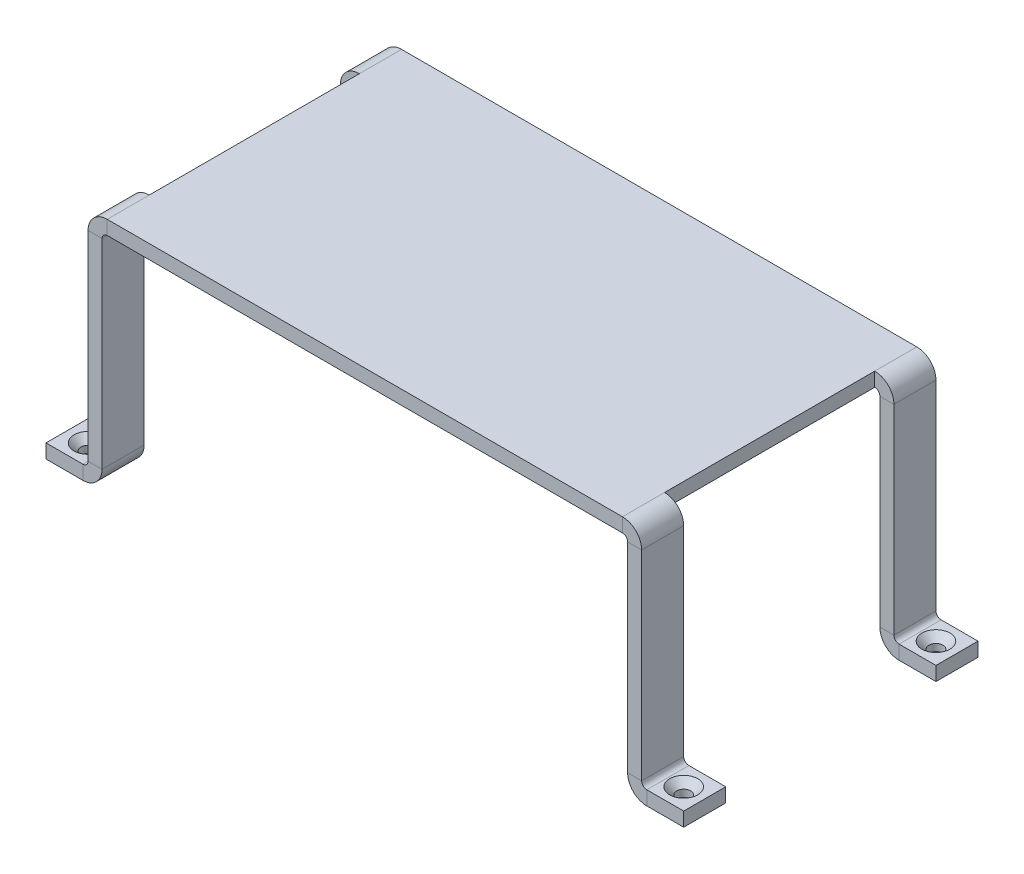
from build123d import *

# Parameters (mm, degrees)
SKETCH_2_W                       = 75
SKETCH_2_H                       = 42
SM_BASE_FLANGE_1_DEPTH           = 2
SM_EDGE_FLANGE_1_STRIP_W         = 9.4732
SM_EDGE_FLANGE_1_STRIP_H         = 2
SM_EDGE_FLANGE_1_STRIP_CUT_DEPTH = 42
SM_EDGE_FLANGE_1_DEPTH           = 42
SM_EDGE_FLANGE_2_STRIP_W         = 9.4732
SM_EDGE_FLANGE_2_STRIP_H         = 2
SM_EDGE_FLANGE_2_STRIP_CUT_DEPTH = 42
SM_EDGE_FLANGE_2_DEPTH           = 42
SM_EDGE_FLANGE_3_STRIP_W         = 9.4732
SM_EDGE_FLANGE_3_STRIP_H         = 2
SM_EDGE_FLANGE_3_STRIP_CUT_DEPTH = 42
SM_EDGE_FLANGE_3_DEPTH           = 42
SM_EDGE_FLANGE_4_STRIP_W         = 9.4732
SM_EDGE_FLANGE_4_STRIP_H         = 2
SM_EDGE_FLANGE_4_STRIP_CUT_DEPTH = 42
SM_EDGE_FLANGE_4_DEPTH           = 42
HOLE_WIZARD_M2_4_AT_2_COUNT      = 2
HOLE_WIZARD_M2_4_AT_2_PITCH      = 36
HOLE_WIZARD_M2_4_AT_3_COUNT      = 2
HOLE_WIZARD_M2_4_AT_3_PITCH      = 85
HOLE_WIZARD_M2_4_AT_4_COUNT      = 2
HOLE_WIZARD_M2_4_AT_4_PITCH      = 92.309262807
SKETCH_27_W                      = 8.7366
SKETCH_27_H                      = 30
CUT_EXTRUDE_2319_DEPTH           = 38


# Sheet-metal steps are written as plain solids
with BuildPart() as part:
    # Sketch 2 → 基体-法兰1 (new body)
    with BuildSketch(Plane(origin=(0, 0, 0), x_dir=(1, 0, 0), z_dir=(0, 1, 0))):
        with Locations((21.966960091, -5.622610863)):
            Rectangle(SKETCH_2_W, SKETCH_2_H)
    extrude(amount=-SM_BASE_FLANGE_1_DEPTH)

    # 边线-法兰1 strip (across the edge) → 边线-法兰1 strip cut (cut)
    with BuildSketch(Plane(origin=(-15.533039909, -2, 26.622610863), x_dir=(1, 0, 0), z_dir=(0, 0, -1))):
        with Locations((-4, -1)):
            Rectangle(SM_EDGE_FLANGE_1_STRIP_W, SM_EDGE_FLANGE_1_STRIP_H)
    extrude(amount=SM_EDGE_FLANGE_1_STRIP_CUT_DEPTH, mode=Mode.SUBTRACT)

    # 边线-法兰1 section (across the edge) → 边线-法兰1 (add)
    with BuildSketch(Plane(origin=(-15.533039909, -2, 26.622610863), x_dir=(1, 0, 0), z_dir=(0, 0, -1))):
        with BuildLine():
            Line((-2, 0.7366), (-2, 30))
            Line((-2, 30), (0, 30))
            Line((0, 30), (0, 0.7366))
            ThreePointArc((0, 0.7366), (0.215745145, 0.215745145), (0.7366, 0))
            Line((0.7366, 0), (0.7366, -2))
            ThreePointArc((0.7366, -2), (-1.198468417, -1.198468417), (-2, 0.7366))
        make_face()
    extrude(amount=SM_EDGE_FLANGE_1_DEPTH)

    # 边线-法兰2 strip (across the edge) → 边线-法兰2 strip cut (cut)
    with BuildSketch(Plane(origin=(59.466960091, -2, -15.377389137), x_dir=(-1, 0, 0), z_dir=(0, 0, 1))):
        with Locations((-4, -1)):
            Rectangle(SM_EDGE_FLANGE_2_STRIP_W, SM_EDGE_FLANGE_2_STRIP_H)
    extrude(amount=SM_EDGE_FLANGE_2_STRIP_CUT_DEPTH, mode=Mode.SUBTRACT)

    # 边线-法兰2 section (across the edge) → 边线-法兰2 (add)
    with BuildSketch(Plane(origin=(59.466960091, -2, -15.377389137), x_dir=(-1, 0, 0), z_dir=(0, 0, 1))):
        with BuildLine():
            Line((-2, 0.7366), (-2, 30))
            Line((-2, 30), (0, 30))
            Line((0, 30), (0, 0.7366))
            ThreePointArc((0, 0.7366), (0.215745145, 0.215745145), (0.7366, 0))
            Line((0.7366, 0), (0.7366, -2))
            ThreePointArc((0.7366, -2), (-1.198468417, -1.198468417), (-2, 0.7366))
        make_face()
    extrude(amount=SM_EDGE_FLANGE_2_DEPTH)

    # 边线-法兰3 strip (across the edge) → 边线-法兰3 strip cut (cut)
    with BuildSketch(Plane(origin=(-17.533039909, -32, -15.377389137), x_dir=(0, 1, 0), z_dir=(0, 0, 1))):
        with Locations((-4, -1)):
            Rectangle(SM_EDGE_FLANGE_3_STRIP_W, SM_EDGE_FLANGE_3_STRIP_H)
    extrude(amount=SM_EDGE_FLANGE_3_STRIP_CUT_DEPTH, mode=Mode.SUBTRACT)

    # 边线-法兰3 section (across the edge) → 边线-法兰3 (add)
    with BuildSketch(Plane(origin=(-17.533039909, -32, -15.377389137), x_dir=(0, 1, 0), z_dir=(0, 0, 1))):
        with BuildLine():
            Line((-2, 0.7366), (-2, 6))
            Line((-2, 6), (0, 6))
            Line((0, 6), (0, 0.7366))
            ThreePointArc((0, 0.7366), (0.215745145, 0.215745145), (0.7366, 0))
            Line((0.7366, 0), (0.7366, -2))
            ThreePointArc((0.7366, -2), (-1.198468417, -1.198468417), (-2, 0.7366))
        make_face()
    extrude(amount=SM_EDGE_FLANGE_3_DEPTH)

    # 边线-法兰4 strip (across the edge) → 边线-法兰4 strip cut (cut)
    with BuildSketch(Plane(origin=(61.466960091, -32, 26.622610863), x_dir=(0, 1, 0), z_dir=(0, 0, -1))):
        with Locations((-4, -1)):
            Rectangle(SM_EDGE_FLANGE_4_STRIP_W, SM_EDGE_FLANGE_4_STRIP_H)
    extrude(amount=SM_EDGE_FLANGE_4_STRIP_CUT_DEPTH, mode=Mode.SUBTRACT)

    # 边线-法兰4 section (across the edge) → 边线-法兰4 (add)
    with BuildSketch(Plane(origin=(61.466960091, -32, 26.622610863), x_dir=(0, 1, 0), z_dir=(0, 0, -1))):
        with BuildLine():
            Line((-2, 0.7366), (-2, 6))
            Line((-2, 6), (0, 6))
            Line((0, 6), (0, 0.7366))
            ThreePointArc((0, 0.7366), (0.215745145, 0.215745145), (0.7366, 0))
            Line((0.7366, 0), (0.7366, -2))
            ThreePointArc((0.7366, -2), (-1.198468417, -1.198468417), (-2, 0.7366))
        make_face()
    extrude(amount=SM_EDGE_FLANGE_4_DEPTH)

    # 草图26 → M2*4 (revolve, cut)
    with BuildSketch(Plane(origin=(-20.533039909, -32, -12.377389137), x_dir=(0, 0, 1), z_dir=(1, 0, 0))):
        Polygon((0, 0), (0, 2), (1, 2), (1, 1), (2, 0), align=None)
    hole_wizard_m2_4 = revolve(axis=Axis((-20.533039909, -25.65, -12.377389137), (0, -1, 0)), mode=Mode.SUBTRACT)

    # M2*4 at 2: M2*4 ×2
    with Locations(*[(0, 0, i * HOLE_WIZARD_M2_4_AT_2_PITCH) for i in range(1, HOLE_WIZARD_M2_4_AT_2_COUNT)]):
        add(hole_wizard_m2_4, mode=Mode.SUBTRACT)

    # M2*4 at 3: M2*4 ×2
    with Locations(*[(i * HOLE_WIZARD_M2_4_AT_3_PITCH, 0, 0) for i in range(1, HOLE_WIZARD_M2_4_AT_3_COUNT)]):
        add(hole_wizard_m2_4, mode=Mode.SUBTRACT)

    # M2*4 at 4: M2*4 ×2
    with Locations(*[Vector(0.9208176667771376, 0, 0.38999336475266905) * (i * HOLE_WIZARD_M2_4_AT_4_PITCH) for i in range(1, HOLE_WIZARD_M2_4_AT_4_COUNT)]):
        add(hole_wizard_m2_4, mode=Mode.SUBTRACT)

    # 草图27 → Cut-Extrude 2319 (cut)
    with BuildSketch(Plane(origin=(0, 0, 0), x_dir=(1, 0, 0), z_dir=(0, 1, 0))):
        with Locations((-19.164739909, -5.622610863)):
            Rectangle(SKETCH_27_W, SKETCH_27_H)
        with Locations((63.098660091, -5.622610863)):
            Rectangle(SKETCH_27_W, SKETCH_27_H)
    extrude(amount=-CUT_EXTRUDE_2319_DEPTH, mode=Mode.SUBTRACT)


solid = part.part
